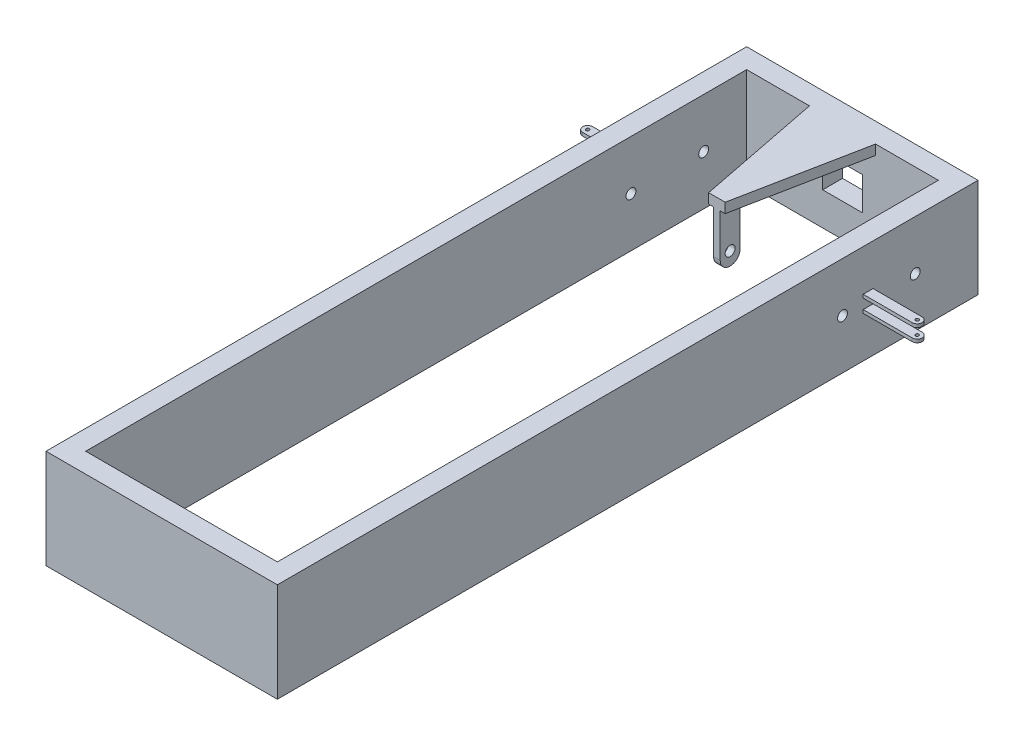
from build123d import *

# Parameters (mm, degrees)
SKETCH1_W            = 70
SKETCH1_H            = 212
SKETCH1_W_2          = 58
SKETCH1_H_2          = 200
BOSS_EXTRUDE1_DEPTH  = 30
SKETCH10_W           = 2
SKETCH10_H           = 6
BOSS_EXTRUDE3_DEPTH  = 16
FILLET2_R            = 3
SKETCH2_R            = 1.5
CUT_EXTRUDE1_DEPTH   = 131.52202895
CUT_EXTRUDE2_REACH   = 218.954
SKETCH3_W            = 12
SKETCH3_H            = 10
SKETCH4_W            = 3
SKETCH4_H            = 1
BOSS_EXTRUDE2_DEPTH  = 16.35
FILLET1_R            = 1.5
SKETCH6_R            = 0.5
CUT_EXTRUDE4_DEPTH   = 120.075910751
FILLET1_OF_MIRROR2_R = 1.5


with BuildPart() as part:
    # Sketch1 → Boss-Extrude1 (new body)
    with BuildSketch(Plane(origin=(0, 0, 0), x_dir=(1, 0, 0), z_dir=(0, 1, 0))):
        Rectangle(SKETCH1_W, SKETCH1_H)
        Rectangle(SKETCH1_W_2, SKETCH1_H_2, mode=Mode.SUBTRACT)
    extrude(amount=BOSS_EXTRUDE1_DEPTH)

    # Sketch7 → Loft3 section 0
    with BuildSketch(Plane.XY.offset(-100)):
        with BuildLine():
            Line((-10, 30), (10, 30))
            Line((10, 30), (10, 27))
            Line((10, 27), (-10, 27))
            Line((-10, 27), (-10, 30))
        make_face()
    # Sketch8 → Loft3 section 1
    with BuildSketch(Plane.XY.offset(-62)):
        with BuildLine():
            Line((-2.5, 30), (2.5, 30))
            Line((2.5, 30), (2.5, 27))
            Line((2.5, 27), (-2.5, 27))
            Line((-2.5, 27), (-2.5, 30))
        make_face()
    loft()

    # Sketch10 → Boss-Extrude3 (add)
    with BuildSketch(Plane.XZ.offset(-27)):
        with Locations((0, -65)):
            Rectangle(SKETCH10_W, SKETCH10_H)
    extrude(amount=BOSS_EXTRUDE3_DEPTH)

    # Fillet2
    fillet2_edges = [part.edges().sort_by_distance(p)[0] for p in [
        (0, 11, -68),
        (0, 11, -62),
    ]]
    fillet(fillet2_edges, radius=FILLET2_R - 0.0001)  # a hair under: the kernel refuses the full size

    # Sketch2 → Cut-Extrude1 (cut, through all)
    with BuildSketch(Plane(origin=(35, 0, 0), x_dir=(0, 0, -1), z_dir=(1, 0, 0))):
        with Locations(Location((65, 15, 0), (0, 0, 270))):
            Circle(SKETCH2_R)
        with Locations((87, 15)):
            Circle(SKETCH2_R)
    extrude(amount=-CUT_EXTRUDE1_DEPTH, mode=Mode.SUBTRACT)

    # Sketch3 → Cut-Extrude2 (cut, up to next)
    with BuildSketch(Plane(origin=(0, 0, -106), x_dir=(-1, 0, 0), z_dir=(0, 0, -1)), mode=Mode.PRIVATE) as cut_extrude2_sk1:
        with Locations((0, 15)):
            Rectangle(SKETCH3_W, SKETCH3_H)
    cut_extrude2_tool1 = extrude(cut_extrude2_sk1.sketch, amount=-CUT_EXTRUDE2_REACH, mode=Mode.PRIVATE) & part.part
    add(cut_extrude2_tool1.solids().sort_by_distance((0, 15, -106))[0], mode=Mode.SUBTRACT)

    # Sketch4 → Boss-Extrude2 (add)
    with BuildSketch(Plane(origin=(35, 0, 0), x_dir=(0, 0, -1), z_dir=(1, 0, 0))):
        with Locations((72.75, 13)):
            Rectangle(SKETCH4_W, SKETCH4_H)
        with Locations((72.75, 17)):
            Rectangle(SKETCH4_W, SKETCH4_H)
    boss_extrude2 = extrude(amount=BOSS_EXTRUDE2_DEPTH)

    # Fillet1
    fillet1_edges = [part.edges().sort_by_distance(p)[0] for p in [
        (51.35, 13, -74.25),
        (51.35, 13, -71.25),
        (51.35, 17, -71.25),
        (51.35, 17, -74.25),
    ]]
    fillet(fillet1_edges, radius=FILLET1_R - 0.0001)  # a hair under: the kernel refuses the full size

    # Sketch6 → Cut-Extrude4 (cut, through all)
    with BuildSketch(Plane(origin=(0, 17.5, 0), x_dir=(1, 0, 0), z_dir=(0, 1, 0))):
        with Locations(Location((49.85, 72.75, 0), (0, 0, 270))):
            Circle(SKETCH6_R)
    cut_extrude4 = extrude(amount=-CUT_EXTRUDE4_DEPTH, mode=Mode.SUBTRACT)

    # Mirror2: Boss-Extrude2, Cut-Extrude4 across plane
    add(boss_extrude2.mirror(Plane(origin=(0, 0, 0), x_dir=(0, 0, 1), z_dir=(1, 0, 0))))
    add(cut_extrude4.mirror(Plane(origin=(0, 0, 0), x_dir=(0, 0, 1), z_dir=(1, 0, 0))), mode=Mode.SUBTRACT)

    # Fillet1 of Mirror2
    fillet1_of_mirror2_edges = [part.edges().sort_by_distance(p)[0] for p in [
        (-51.35, 13, -74.25),
        (-51.35, 13, -71.25),
        (-51.35, 17, -71.25),
        (-51.35, 17, -74.25),
    ]]
    fillet(fillet1_of_mirror2_edges, radius=FILLET1_OF_MIRROR2_R - 0.0001)  # a hair under: the kernel refuses the full size


solid = part.part
